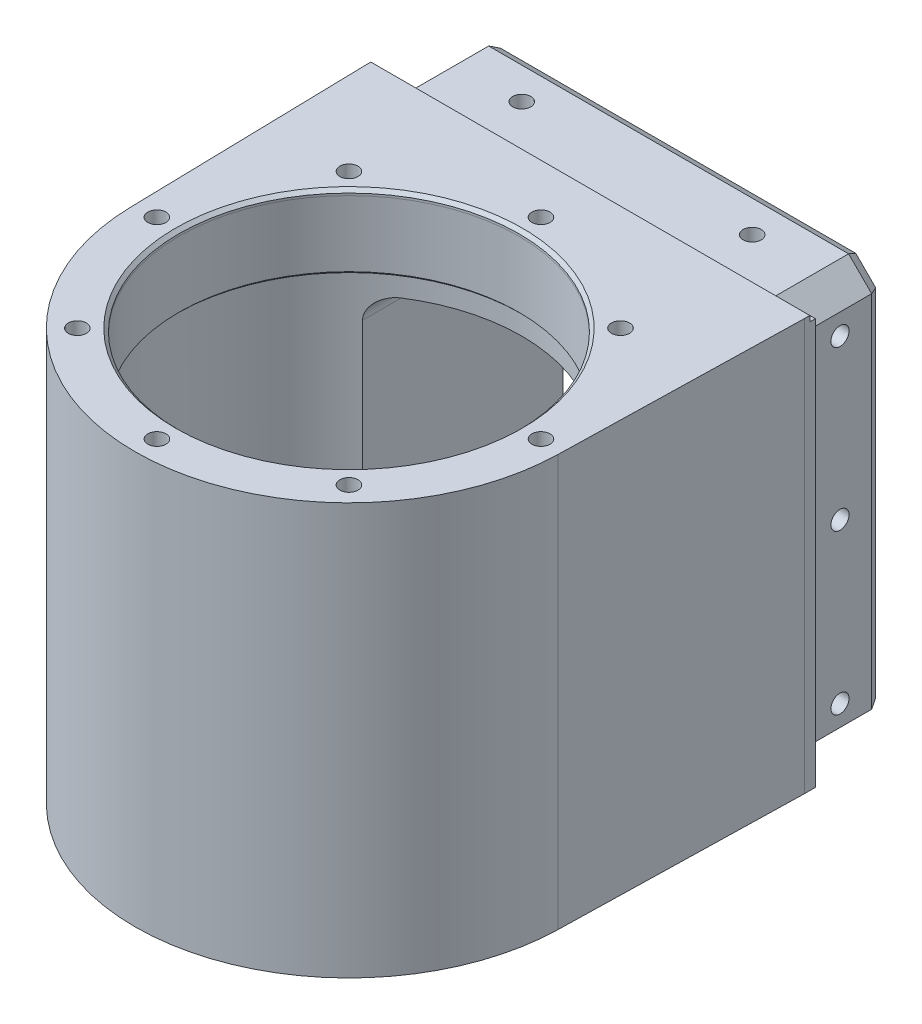
from build123d import *

# Parameters (mm, degrees)
BOSS_EXTRUDE1_REACH             = 103.485
BOSS_EXTRUDE1_DIRECTION_2_REACH = 103.485
SKETCH4_W                       = 74
SKETCH4_H                       = 74
BOSS_EXTRUDE2_DEPTH             = 15
SKETCH11_W                      = 2.15
SKETCH11_H                      = 3
M4_CLEARANCE_HOLE1_AT_2_COUNT   = 2
M4_CLEARANCE_HOLE1_AT_2_PITCH   = 26.787840266
M4_CLEARANCE_HOLE1_AT_3_COUNT   = 2
M4_CLEARANCE_HOLE1_AT_3_PITCH   = 49.497474683
M4_CLEARANCE_HOLE1_AT_4_COUNT   = 2
M4_CLEARANCE_HOLE1_AT_4_PITCH   = 64.671567276
M4_CLEARANCE_HOLE1_AT_5_COUNT   = 2
M4_CLEARANCE_HOLE1_AT_5_PITCH   = 70
M4_CLEARANCE_HOLE1_AT_6_COUNT   = 2
M4_CLEARANCE_HOLE1_AT_6_PITCH   = 64.671567276
M4_CLEARANCE_HOLE1_AT_7_COUNT   = 2
M4_CLEARANCE_HOLE1_AT_7_PITCH   = 49.497474683
M4_CLEARANCE_HOLE1_AT_8_COUNT   = 2
M4_CLEARANCE_HOLE1_AT_8_PITCH   = 26.787840266
M4_TAPPED_HOLE1_AT_2_COUNT      = 2
M4_TAPPED_HOLE1_AT_2_PITCH      = 26.787840266
M4_TAPPED_HOLE1_AT_3_COUNT      = 2
M4_TAPPED_HOLE1_AT_3_PITCH      = 49.497474683
M4_TAPPED_HOLE1_AT_4_COUNT      = 2
M4_TAPPED_HOLE1_AT_4_PITCH      = 26.787840266
M4_TAPPED_HOLE1_AT_5_COUNT      = 2
M4_TAPPED_HOLE1_AT_5_PITCH      = 49.497474683
M4_TAPPED_HOLE1_AT_6_COUNT      = 2
M4_TAPPED_HOLE1_AT_6_PITCH      = 64.671567276
M4_TAPPED_HOLE1_AT_7_COUNT      = 2
M4_TAPPED_HOLE1_AT_7_PITCH      = 70
M4_TAPPED_HOLE1_AT_8_COUNT      = 2
M4_TAPPED_HOLE1_AT_8_PITCH      = 64.671567276
CUT_EXTRUDE3_DEPTH              = 1
CHAMFER1_SIZE                   = 4.2
CHAMFER2_SIZE                   = 1
CHAMFER2_SIZE2                  = 1.732050808
FILLET1_R                       = 0.3
CHAMFER3_SIZE                   = 0.6
CHAMFER4_SIZE                   = 0.5
FILLET2_R                       = 0.4
CUT_EXTRUDE4_REACH              = 116.557
CUT_EXTRUDE4_END_RADIUS         = 31.5


with BuildPart() as part:
    # Sketch1 → Revolve1 (revolve)
    with BuildSketch(Plane(origin=(0, 0, 0), x_dir=(0, 0, -1), z_dir=(1, 0, 0))):
        Polygon((-14, -34), (-16, -34), (-16, -37), (-6, -37), (-6, 38), (-14, 38), (-14, 25), (-13.5, 25), (-13.5, -22), (-14, -22), align=None)
    revolve(axis=Axis((0, -41, 45), (0, 1, 0)))

    # Boss-Extrude1: up to this face of the body (flat: up to its plane)
    boss_extrude1_end = Plane(part.part.faces().sort_by_distance((0, 38, 82.896913421))[0])
    # Sketch3 → Boss-Extrude1 (add, up to the picked face)
    with BuildSketch(Plane(origin=(0, 0, 0), x_dir=(1, 0, 0), z_dir=(0, 1, 0)), mode=Mode.PRIVATE) as boss_extrude1_sk1:
        with BuildLine():
            Line((-40, -2), (-38.989674582, -45.897371704))
            ThreePointArc((-38.989674582, -45.897371704), (0, -6), (38.989674582, -45.897371704))
            Line((38.989674582, -45.897371704), (40, -2))
            Line((40, -2), (40, 0))
            Line((40, 0), (-40, 0))
            Line((-40, 0), (-40, -2))
        make_face()
    boss_extrude1_tool1 = split(extrude(boss_extrude1_sk1.sketch, amount=BOSS_EXTRUDE1_REACH, mode=Mode.PRIVATE), bisect_by=boss_extrude1_end, keep=Keep.BOTH, mode=Mode.PRIVATE)
    add(boss_extrude1_tool1.solids().sort_by(Axis((-38.572771, 0, 23.927464), (0, 1, 0)))[0])

    # Boss-Extrude1 direction 2: up to this face of the body (flat: up to its plane)
    boss_extrude1_direction_2_end = Plane(part.part.faces().sort_by_distance((0, -37, 75.103086579))[0])
    # Sketch3 → Boss-Extrude1 direction 2 (add, up to the picked face)
    with BuildSketch(Plane(origin=(0, 0, 0), x_dir=(1, 0, 0), z_dir=(0, 1, 0)), mode=Mode.PRIVATE) as boss_extrude1_direction_2_sk1:
        with BuildLine():
            Line((-40, -2), (-38.989674582, -45.897371704))
            ThreePointArc((-38.989674582, -45.897371704), (0, -6), (38.989674582, -45.897371704))
            Line((38.989674582, -45.897371704), (40, -2))
            Line((40, -2), (40, 0))
            Line((40, 0), (-40, 0))
            Line((-40, 0), (-40, -2))
        make_face()
    boss_extrude1_direction_2_tool1 = split(extrude(boss_extrude1_direction_2_sk1.sketch, amount=-BOSS_EXTRUDE1_DIRECTION_2_REACH, mode=Mode.PRIVATE), bisect_by=boss_extrude1_direction_2_end, keep=Keep.BOTH, mode=Mode.PRIVATE)
    add(boss_extrude1_direction_2_tool1.solids().sort_by(Axis((-38.572771, 0, 23.927464), (0, -1, 0)))[0])

    # Sketch4 → Boss-Extrude2 (add)
    with BuildSketch(Plane(origin=(0, 0, 0), x_dir=(-1, 0, 0), z_dir=(0, 0, -1))):
        Rectangle(SKETCH4_W, SKETCH4_H)
    extrude(amount=BOSS_EXTRUDE2_DEPTH)

    # Sketch16 → M4 Tapped Hole1 (revolve, cut)
    with BuildSketch(Plane(origin=(0, 38, 10), x_dir=(0, 0, 1), z_dir=(1, 0, 0))):
        Polygon((0, 0), (0, 12.491420021), (1.65, 11.5), (1.65, 0), align=None)
    m4_tapped_hole1 = revolve(axis=Axis((0, 44.35, 10), (0, -1, 0)), mode=Mode.SUBTRACT)

    # M4 Tapped Hole1 at 2: M4 Tapped Hole1 ×2
    with Locations(*[Vector(0.9238795325112865, 0, 0.3826834323650906) * (i * M4_TAPPED_HOLE1_AT_2_PITCH) for i in range(1, M4_TAPPED_HOLE1_AT_2_COUNT)]):
        add(m4_tapped_hole1, mode=Mode.SUBTRACT)

    # M4 Tapped Hole1 at 3: M4 Tapped Hole1 ×2
    with Locations(*[Vector(0.7071067811865465, 0, 0.7071067811865487) * (i * M4_TAPPED_HOLE1_AT_3_PITCH) for i in range(1, M4_TAPPED_HOLE1_AT_3_COUNT)]):
        add(m4_tapped_hole1, mode=Mode.SUBTRACT)

    # M4 Tapped Hole1 at 4: M4 Tapped Hole1 ×2
    with Locations(*[Vector(-0.9238795325112892, 0, 0.3826834323650839) * (i * M4_TAPPED_HOLE1_AT_4_PITCH) for i in range(1, M4_TAPPED_HOLE1_AT_4_COUNT)]):
        add(m4_tapped_hole1, mode=Mode.SUBTRACT)

    # M4 Tapped Hole1 at 5: M4 Tapped Hole1 ×2
    with Locations(*[Vector(-0.7071067811865513, 0, 0.7071067811865437) * (i * M4_TAPPED_HOLE1_AT_5_PITCH) for i in range(1, M4_TAPPED_HOLE1_AT_5_COUNT)]):
        add(m4_tapped_hole1, mode=Mode.SUBTRACT)

    # M4 Tapped Hole1 at 6: M4 Tapped Hole1 ×2
    with Locations(*[Vector(-0.38268343236509383, 0, 0.9238795325112851) * (i * M4_TAPPED_HOLE1_AT_6_PITCH) for i in range(1, M4_TAPPED_HOLE1_AT_6_COUNT)]):
        add(m4_tapped_hole1, mode=Mode.SUBTRACT)

    # M4 Tapped Hole1 at 7: M4 Tapped Hole1 ×2
    with Locations(*[(0, 0, i * M4_TAPPED_HOLE1_AT_7_PITCH) for i in range(1, M4_TAPPED_HOLE1_AT_7_COUNT)]):
        add(m4_tapped_hole1, mode=Mode.SUBTRACT)

    # M4 Tapped Hole1 at 8: M4 Tapped Hole1 ×2
    with Locations(*[Vector(0.3826834323650873, 0, 0.9238795325112877) * (i * M4_TAPPED_HOLE1_AT_8_PITCH) for i in range(1, M4_TAPPED_HOLE1_AT_8_COUNT)]):
        add(m4_tapped_hole1, mode=Mode.SUBTRACT)

    # Sketch19 → Cut-Extrude3 (cut)
    with BuildSketch(Plane(origin=(0, 0, 0), x_dir=(-1, 0, 0), z_dir=(0, 0, -1))):
        Polygon((40, -37), (37, -37), (37, 37), (-37, 37), (-40, 37), (-40, 38), (40, 38), align=None)
    extrude(amount=-CUT_EXTRUDE3_DEPTH, mode=Mode.SUBTRACT)

    # Sketch9 → M4 Tapped Hole2 (revolve, cut)
    with BuildSketch(Plane(origin=(37, 29, -7.5), x_dir=(0, 0, -1), z_dir=(0, 1, 0))):
        Polygon((0, 0), (0, 11.091420021), (1.65, 10.1), (1.65, 0), align=None)
    revolve(axis=Axis((43.35, 29, -7.5), (-1, 0, 0)), mode=Mode.SUBTRACT)

    # Sketch9 at point 2 (carried to point 2, square into its face) → M4 Tapped Hole2 at 2 (revolve, cut)
    with BuildSketch(Plane(origin=(37, -29, -7.5), x_dir=(0, 0, -1), z_dir=(0, 1, 0))):
        Polygon((0, 0), (0, 11.091420021), (1.65, 10.1), (1.65, 0), align=None)
    revolve(axis=Axis((43.35, -29, -7.5), (-1, 0, 0)), mode=Mode.SUBTRACT)

    # Sketch9 at point 3 (carried to point 3, square into its face) → M4 Tapped Hole2 at 3 (revolve, cut)
    with BuildSketch(Plane(origin=(-37, -29, -7.5), x_dir=(0, 0, -1), z_dir=(0, -1, 0))):
        Polygon((0, 0), (0, 11.091420021), (1.65, 10.1), (1.65, 0), align=None)
    revolve(axis=Axis((-43.35, -29, -7.5), (1, 0, 0)), mode=Mode.SUBTRACT)

    # Sketch9 at point 4 (carried to point 4, square into its face) → M4 Tapped Hole2 at 4 (revolve, cut)
    with BuildSketch(Plane(origin=(-37, 29, -7.5), x_dir=(0, 0, -1), z_dir=(0, -1, 0))):
        Polygon((0, 0), (0, 11.091420021), (1.65, 10.1), (1.65, 0), align=None)
    revolve(axis=Axis((-43.35, 29, -7.5), (1, 0, 0)), mode=Mode.SUBTRACT)

    # Sketch9 at point 5 (carried to point 5, square into its face) → M4 Tapped Hole2 at 5 (revolve, cut)
    with BuildSketch(Plane(origin=(37, 0, -7.5), x_dir=(0, 0, -1), z_dir=(0, 1, 0))):
        Polygon((0, 0), (0, 11.091420021), (1.65, 10.1), (1.65, 0), align=None)
    revolve(axis=Axis((43.35, 0, -7.5), (-1, 0, 0)), mode=Mode.SUBTRACT)

    # Sketch9 at point 6 (carried to point 6, square into its face) → M4 Tapped Hole2 at 6 (revolve, cut)
    with BuildSketch(Plane(origin=(-37, 0, -7.5), x_dir=(0, 0, -1), z_dir=(0, -1, 0))):
        Polygon((0, 0), (0, 11.091420021), (1.65, 10.1), (1.65, 0), align=None)
    revolve(axis=Axis((-43.35, 0, -7.5), (1, 0, 0)), mode=Mode.SUBTRACT)

    # Sketch9 at point 7 (carried to point 7, square into its face) → M4 Tapped Hole2 at 7 (revolve, cut)
    with BuildSketch(Plane(origin=(21, 37, -7.5), x_dir=(0, 0, -1), z_dir=(-1, 0, 0))):
        Polygon((0, 0), (0, 11.091420021), (1.65, 10.1), (1.65, 0), align=None)
    revolve(axis=Axis((21, 43.35, -7.5), (0, -1, 0)), mode=Mode.SUBTRACT)

    # Sketch9 at point 8 (carried to point 8, square into its face) → M4 Tapped Hole2 at 8 (revolve, cut)
    with BuildSketch(Plane(origin=(-21, 37, -7.5), x_dir=(0, 0, -1), z_dir=(-1, 0, 0))):
        Polygon((0, 0), (0, 11.091420021), (1.65, 10.1), (1.65, 0), align=None)
    revolve(axis=Axis((-21, 43.35, -7.5), (0, -1, 0)), mode=Mode.SUBTRACT)

    # Sketch9 at point 9 (carried to point 9, square into its face) → M4 Tapped Hole2 at 9 (revolve, cut)
    with BuildSketch(Plane(origin=(-21, -37, -7.5), x_dir=(0, 0, -1), z_dir=(1, 0, 0))):
        Polygon((0, 0), (0, 11.091420021), (1.65, 10.1), (1.65, 0), align=None)
    revolve(axis=Axis((-21, -43.35, -7.5), (0, 1, 0)), mode=Mode.SUBTRACT)

    # Sketch9 at point 10 (carried to point 10, square into its face) → M4 Tapped Hole2 at 10 (revolve, cut)
    with BuildSketch(Plane(origin=(21, -37, -7.5), x_dir=(0, 0, -1), z_dir=(1, 0, 0))):
        Polygon((0, 0), (0, 11.091420021), (1.65, 10.1), (1.65, 0), align=None)
    revolve(axis=Axis((21, -43.35, -7.5), (0, 1, 0)), mode=Mode.SUBTRACT)

    # Chamfer1
    chamfer1_edges = [part.edges().sort_by_distance(p)[0] for p in [
        (-37, 37, -7),
        (37, 37, -7.5),
        (37, -37, -7.5),
        (-37, -37, -7),
    ]]
    chamfer(chamfer1_edges, length=CHAMFER1_SIZE)

    # Chamfer2
    chamfer2_edges = [part.edges().sort_by_distance(p)[0] for p in [
        (0, 37, -15),
        (-37, 0, -15),
        (37, 0, -15),
        (0, -37, -15),
        (34.9, 34.9, -15),
        (34.9, -34.9, -15),
        (-34.9, -34.9, -15),
        (-34.9, 34.9, -15),
    ]]
    chamfer2_side = [part.faces().sort_by_distance(p)[0] for p in [
        (0, 0, -15),
    ]]
    chamfer(chamfer2_edges, length=CHAMFER2_SIZE, length2=CHAMFER2_SIZE2, reference=chamfer2_side[0])

    # Fillet1
    fillet1_edges = [part.edges().sort_by_distance(p)[0] for p in [
        (0, -34, 76),
    ]]
    fillet(fillet1_edges, radius=FILLET1_R)

    # Chamfer3
    chamfer3_edges = [part.edges().sort_by_distance(p)[0] for p in [
        (0, 38, 76),
    ]]
    chamfer(chamfer3_edges, length=CHAMFER3_SIZE)

    # Chamfer4
    chamfer4_edges = [part.edges().sort_by_distance(p)[0] for p in [
        (0, 25, 76.5),
        (0, -22, 76.5),
    ]]
    chamfer(chamfer4_edges, length=CHAMFER4_SIZE - 0.0001)  # a hair under: the kernel refuses the full size

    # Cut-Extrude4: up to this cylinder (the profile starts outside it)
    cut_extrude4_end = Plane(origin=(0, 0, 45), z_dir=(0, -1, 0)) * Cylinder(CUT_EXTRUDE4_END_RADIUS, 297.114, mode=Mode.PRIVATE)
    # Sketch21 → Cut-Extrude4 (cut, up to the surface)
    with BuildSketch(Plane(origin=(0, 0, -15), x_dir=(-1, 0, 0), z_dir=(0, 0, -1)), mode=Mode.PRIVATE) as cut_extrude4_sk1:
        with BuildLine():
            Line((-17, -21), (17, -21))
            ThreePointArc((17, -21), (19.828427125, -19.828427125), (21, -17))
            Line((21, -17), (21, 17))
            ThreePointArc((21, 17), (19.828427125, 19.828427125), (17, 21))
            Line((17, 21), (-17, 21))
            ThreePointArc((-17, 21), (-19.828427125, 19.828427125), (-21, 17))
            Line((-21, 17), (-21, -17))
            ThreePointArc((-21, -17), (-19.828427125, -19.828427125), (-17, -21))
        make_face()
    cut_extrude4_tool1 = extrude(cut_extrude4_sk1.sketch, amount=-CUT_EXTRUDE4_REACH, mode=Mode.PRIVATE) - cut_extrude4_end
    add(cut_extrude4_tool1.solids().sort_by_distance((0, 0, -15))[0], mode=Mode.SUBTRACT)


with BuildPart() as body_2:
    # Sketch2 → Revolve2 (revolve)
    with BuildSketch(Plane(origin=(0, 0, 0), x_dir=(0, 0, -1), z_dir=(1, 0, 0))):
        Polygon((-14, 37), (-16, 37), (-16, 41.5), (-6, 41.5), (-6, 38.5), (-14, 38.5), align=None)
    revolve(axis=Axis((0, -41, 45), (0, 1, 0)))

    # Sketch11 → M4 Clearance Hole1 (revolve, cut)
    with BuildSketch(Plane(origin=(-24.748737342, 41.5, 20.251262658), x_dir=(0, 0, 1), z_dir=(1, 0, 0))):
        with Locations((1.075, 1.5)):
            Rectangle(SKETCH11_W, SKETCH11_H)
    m4_clearance_hole1 = revolve(axis=Axis((-24.748737342, 47.85, 20.251262658), (0, -1, 0)), mode=Mode.SUBTRACT)

    # M4 Clearance Hole1 at 2: M4 Clearance Hole1 ×2
    with Locations(*[Vector(0.9238795325112892, 0, -0.3826834323650839) * (i * M4_CLEARANCE_HOLE1_AT_2_PITCH) for i in range(1, M4_CLEARANCE_HOLE1_AT_2_COUNT)]):
        add(m4_clearance_hole1, mode=Mode.SUBTRACT)

    # M4 Clearance Hole1 at 3: M4 Clearance Hole1 ×2
    with Locations(*[(i * M4_CLEARANCE_HOLE1_AT_3_PITCH, 0, 0) for i in range(1, M4_CLEARANCE_HOLE1_AT_3_COUNT)]):
        add(m4_clearance_hole1, mode=Mode.SUBTRACT)

    # M4 Clearance Hole1 at 4: M4 Clearance Hole1 ×2
    with Locations(*[Vector(0.9238795325112837, 0, 0.38268343236509733) * (i * M4_CLEARANCE_HOLE1_AT_4_PITCH) for i in range(1, M4_CLEARANCE_HOLE1_AT_4_COUNT)]):
        add(m4_clearance_hole1, mode=Mode.SUBTRACT)

    # M4 Clearance Hole1 at 5: M4 Clearance Hole1 ×2
    with Locations(*[Vector(0.707106781186541, 0, 0.707106781186554) * (i * M4_CLEARANCE_HOLE1_AT_5_PITCH) for i in range(1, M4_CLEARANCE_HOLE1_AT_5_COUNT)]):
        add(m4_clearance_hole1, mode=Mode.SUBTRACT)

    # M4 Clearance Hole1 at 6: M4 Clearance Hole1 ×2
    with Locations(*[Vector(0.38268343236508046, 0, 0.9238795325112907) * (i * M4_CLEARANCE_HOLE1_AT_6_PITCH) for i in range(1, M4_CLEARANCE_HOLE1_AT_6_COUNT)]):
        add(m4_clearance_hole1, mode=Mode.SUBTRACT)

    # M4 Clearance Hole1 at 7: M4 Clearance Hole1 ×2
    with Locations(*[(0, 0, i * M4_CLEARANCE_HOLE1_AT_7_PITCH) for i in range(1, M4_CLEARANCE_HOLE1_AT_7_COUNT)]):
        add(m4_clearance_hole1, mode=Mode.SUBTRACT)

    # M4 Clearance Hole1 at 8: M4 Clearance Hole1 ×2
    with Locations(*[Vector(-0.38268343236510083, 0, 0.9238795325112822) * (i * M4_CLEARANCE_HOLE1_AT_8_PITCH) for i in range(1, M4_CLEARANCE_HOLE1_AT_8_COUNT)]):
        add(m4_clearance_hole1, mode=Mode.SUBTRACT)

    # Fillet2
    fillet2_edges = [body_2.edges().sort_by_distance(p)[0] for p in [
        (0, 38.5, 76),
    ]]
    fillet(fillet2_edges, radius=FILLET2_R)


solid = part.part
